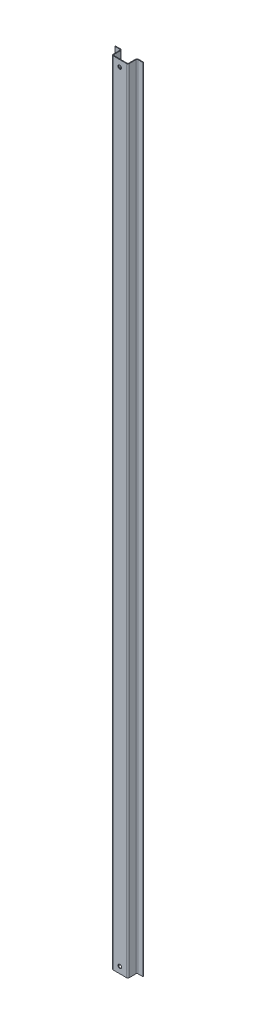
from build123d import *

# Parameters (mm, degrees)
SKETCH1_W                      = 50
SKETCH1_H                      = 2443
BASE_FLANGE1_DEPTH             = 2
EDGE_FLANGE1_STRIP_W           = 13
EDGE_FLANGE1_STRIP_H           = 2
EDGE_FLANGE1_STRIP_CUT_DEPTH   = 2443
EDGE_FLANGE1_STRIP_2_W         = 13
EDGE_FLANGE1_STRIP_2_H         = 2
EDGE_FLANGE1_STRIP_CUT_2_DEPTH = 2443
EDGE_FLANGE1_DEPTH             = 2443
EDGE_FLANGE1_BEND_DEPTH        = 2443
EDGE_FLANGE2_STRIP_W           = 13
EDGE_FLANGE2_STRIP_H           = 2
EDGE_FLANGE2_STRIP_CUT_DEPTH   = 2443
EDGE_FLANGE2_STRIP_2_W         = 13
EDGE_FLANGE2_STRIP_2_H         = 2
EDGE_FLANGE2_STRIP_CUT_2_DEPTH = 2443
EDGE_FLANGE2_DEPTH             = 2443
EDGE_FLANGE2_BEND_DEPTH        = 2443
SKETCH18_R                     = 5.5
CUT_EXTRUDE1_DEPTH             = 10


# Sheet-metal steps are written as plain solids
with BuildPart() as part:
    # Sketch1 → Base-Flange1 (new body)
    with BuildSketch(Plane.XY):
        Rectangle(SKETCH1_W, SKETCH1_H)
    extrude(amount=-BASE_FLANGE1_DEPTH)

    # Edge-Flange1 strip (across the edge) → Edge-Flange1 strip cut (cut)
    with BuildSketch(Plane(origin=(25, 1221.5, -2), x_dir=(-1, 0, 0), z_dir=(0, -1, 0))):
        with Locations((-2, -1)):
            Rectangle(EDGE_FLANGE1_STRIP_W, EDGE_FLANGE1_STRIP_H)
    extrude(amount=EDGE_FLANGE1_STRIP_CUT_DEPTH, mode=Mode.SUBTRACT)

    # Edge-Flange1 strip 2 (across the edge) → Edge-Flange1 strip cut 2 (cut)
    with BuildSketch(Plane(origin=(-25, -1221.5, -2), x_dir=(1, 0, 0), z_dir=(0, 1, 0))):
        with Locations((-2, -1)):
            Rectangle(EDGE_FLANGE1_STRIP_2_W, EDGE_FLANGE1_STRIP_2_H)
    extrude(amount=EDGE_FLANGE1_STRIP_CUT_2_DEPTH, mode=Mode.SUBTRACT)

    # Edge-Flange1 section (across the edge) → Edge-Flange1 (add)
    with BuildSketch(Plane(origin=(25, 1221.5, -2), x_dir=(-1, 0, 0), z_dir=(0, -1, 0))):
        with BuildLine():
            Line((0, 2.5), (0, 28))
            Line((0, 28), (2, 28))
            Line((2, 28), (2, 2.5))
            ThreePointArc((2, 2.5), (2.732233047, 0.732233047), (4.5, 0))
            Line((4.5, 0), (4.5, -2))
            ThreePointArc((4.5, -2), (1.318019485, -0.681980515), (0, 2.5))
        make_face()
    extrude(amount=EDGE_FLANGE1_DEPTH)

    # Edge-Flange1 section 2 (across the edge) → Edge-Flange1 bend (add)
    with BuildSketch(Plane(origin=(-25, -1221.5, -2), x_dir=(1, 0, 0), z_dir=(0, 1, 0))):
        with BuildLine():
            Line((0, 2.5), (0, 28))
            Line((0, 28), (2, 28))
            Line((2, 28), (2, 2.5))
            ThreePointArc((2, 2.5), (2.732233047, 0.732233047), (4.5, 0))
            Line((4.5, 0), (4.5, -2))
            ThreePointArc((4.5, -2), (1.318019485, -0.681980515), (0, 2.5))
        make_face()
    extrude(amount=EDGE_FLANGE1_BEND_DEPTH)

    # Edge-Flange2 strip (across the edge) → Edge-Flange2 strip cut (cut)
    with BuildSketch(Plane(origin=(-25, 1221.5, -30), x_dir=(0, 0, 1), z_dir=(0, -1, 0))):
        with Locations((-2, -1)):
            Rectangle(EDGE_FLANGE2_STRIP_W, EDGE_FLANGE2_STRIP_H)
    extrude(amount=EDGE_FLANGE2_STRIP_CUT_DEPTH, mode=Mode.SUBTRACT)

    # Edge-Flange2 strip 2 (across the edge) → Edge-Flange2 strip cut 2 (cut)
    with BuildSketch(Plane(origin=(25, -1221.5, -30), x_dir=(0, 0, 1), z_dir=(0, 1, 0))):
        with Locations((-2, -1)):
            Rectangle(EDGE_FLANGE2_STRIP_2_W, EDGE_FLANGE2_STRIP_2_H)
    extrude(amount=EDGE_FLANGE2_STRIP_CUT_2_DEPTH, mode=Mode.SUBTRACT)

    # Edge-Flange2 section (across the edge) → Edge-Flange2 (add)
    with BuildSketch(Plane(origin=(-25, 1221.5, -30), x_dir=(0, 0, 1), z_dir=(0, -1, 0))):
        with BuildLine():
            Line((0, 2.5), (0, 18))
            Line((0, 18), (2, 18))
            Line((2, 18), (2, 2.5))
            ThreePointArc((2, 2.5), (2.732233047, 0.732233047), (4.5, 0))
            Line((4.5, 0), (4.5, -2))
            ThreePointArc((4.5, -2), (1.318019485, -0.681980515), (0, 2.5))
        make_face()
    extrude(amount=EDGE_FLANGE2_DEPTH)

    # Edge-Flange2 section 2 (across the edge) → Edge-Flange2 bend (add)
    with BuildSketch(Plane(origin=(25, -1221.5, -30), x_dir=(0, 0, 1), z_dir=(0, 1, 0))):
        with BuildLine():
            Line((0, 2.5), (0, 18))
            Line((0, 18), (2, 18))
            Line((2, 18), (2, 2.5))
            ThreePointArc((2, 2.5), (2.732233047, 0.732233047), (4.5, 0))
            Line((4.5, 0), (4.5, -2))
            ThreePointArc((4.5, -2), (1.318019485, -0.681980515), (0, 2.5))
        make_face()
    extrude(amount=EDGE_FLANGE2_BEND_DEPTH)

    # Sketch18 → Cut-Extrude1 (cut)
    with BuildSketch(Plane(origin=(0, 0, -2), x_dir=(-1, 0, 0), z_dir=(0, 0, -1))):
        with Locations((0, 1201.5)):
            Circle(SKETCH18_R)
    cut_extrude1 = extrude(amount=-CUT_EXTRUDE1_DEPTH, mode=Mode.SUBTRACT)

    # Mirror1: Cut-Extrude1 across plane
    add(cut_extrude1.mirror(Plane.ZX), mode=Mode.SUBTRACT)


solid = part.part
